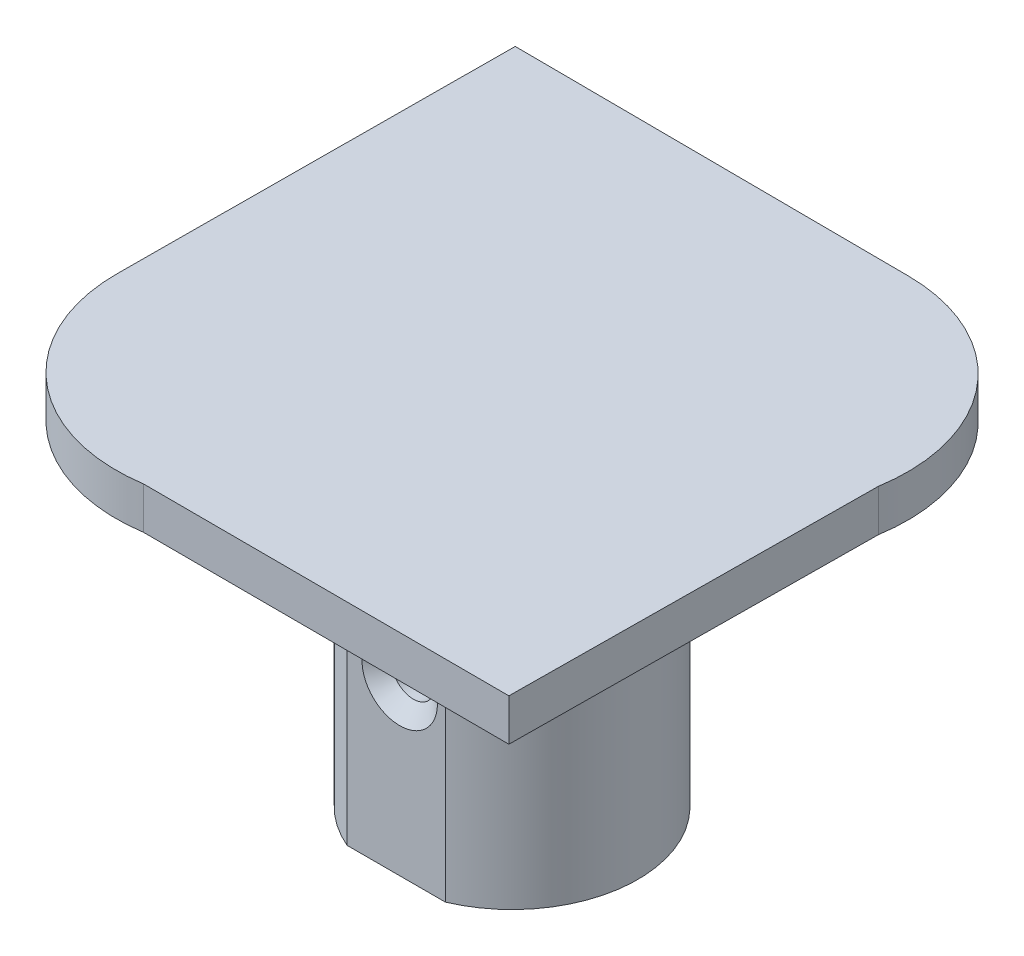
from build123d import *

# Parameters (mm, degrees)
BOSS_EXTRUDE1_DEPTH                         = 3.175
SKETCH2_R                                   = 6.35
BOSS_EXTRUDE2_DEPTH                         = 25.4
CSK_START                                   = -3
CSK_FOR_4_FLAT_HEAD_MACHINE_SCREW_2_R       = 1.63195
CSK_FOR_4_FLAT_HEAD_MACHINE_SCREW_100_DEPTH = 3.290441965
FILLET1_R                                   = 5


with BuildPart() as part:
    # Sketch3 → Boss-Extrude1 (new body)
    with BuildSketch(Plane(origin=(0, 0, 0), x_dir=(1, 0, 0), z_dir=(0, 1, 0))):
        with BuildLine():
            Line((-14.617805765, 29.891737943), (27.723314788, -12.932962722))
            Line((27.723314788, -12.932962722), (0, -12.869393963))
            ThreePointArc((0, -12.869393963), (-10.348328742, -9.868233169), (-14.787821417, -0.050607252))
            Line((-14.787821417, -0.050607252), (-14.617805765, 29.891737943))
        make_face()
        with BuildLine():
            Line((15.324539429, 29.721722291), (-14.617805765, 29.891737943))
            Line((-14.617805765, 29.891737943), (27.723314788, -12.932962722))
            Line((27.723314788, -12.932962722), (27.974571526, 14.789286355))
            ThreePointArc((27.974571526, 14.789286355), (25.091118162, 25.171028529), (15.324539429, 29.721722291))
        make_face()
    extrude(amount=BOSS_EXTRUDE1_DEPTH)

    # Sketch2 → Boss-Extrude2 (add)
    with BuildSketch(Plane(origin=(0, 0, 0), x_dir=(1, 0, 0), z_dir=(0, 1, 0))):
        with BuildLine():
            Line((2.835804927, -0.290441965), (10.269704096, -0.290441965))
            ThreePointArc((10.269704096, -0.290441965), (16.077754512, 8.47938761), (10.269704096, 17.249217186))
            Line((10.269704096, 17.249217186), (2.835804927, 17.249217186))
            ThreePointArc((2.835804927, 17.249217186), (-2.972245488, 8.47938761), (2.835804927, -0.290441965))
        make_face()
        with Locations(Location((6.552754512, 8.47938761, 0), (0, 0, 270))):
            Circle(SKETCH2_R, mode=Mode.SUBTRACT)
    extrude(amount=-BOSS_EXTRUDE2_DEPTH)

    # CSK for #4 Flat Head Machine Screw (100)1: read off the stored shape, not the designer's step
    # CSK for _4 Flat Head Machine Screw _ 2 → CSK for #4 Flat Head Machine Screw (100)1 (cut)
    with BuildSketch(Plane.XY.offset(CSK_START)):
        with Locations((6.81485322, -12.7)):
            Circle(CSK_FOR_4_FLAT_HEAD_MACHINE_SCREW_2_R)
    extrude(amount=CSK_FOR_4_FLAT_HEAD_MACHINE_SCREW_100_DEPTH, mode=Mode.SUBTRACT)

    # CSK for _4 Flat Head Machine Screw _ 3 o → CSK for _4 Flat Head Machine Screw _ 3 (revolve, cut)
    with BuildSketch(Plane(origin=(6.81485322, -12.7, 0), x_dir=(1, 0, 0), z_dir=(0, -1, 0))):
        Polygon((1.63195, 0.290441965), (1.63195, -0.737916588), (2.8575, 0.290441965), align=None)
    revolve(axis=Axis((6.81485322, -12.7, 0), (0, 0, 1)), mode=Mode.SUBTRACT)

    # Fillet1
    fillet1_edges = [part.edges().sort_by_distance(p)[0] for p in [
        (-2.972245488, 0, -8.47938761),
        (16.077754512, 0, -8.47938761),
    ]]
    fillet(fillet1_edges, radius=FILLET1_R)


solid = part.part
